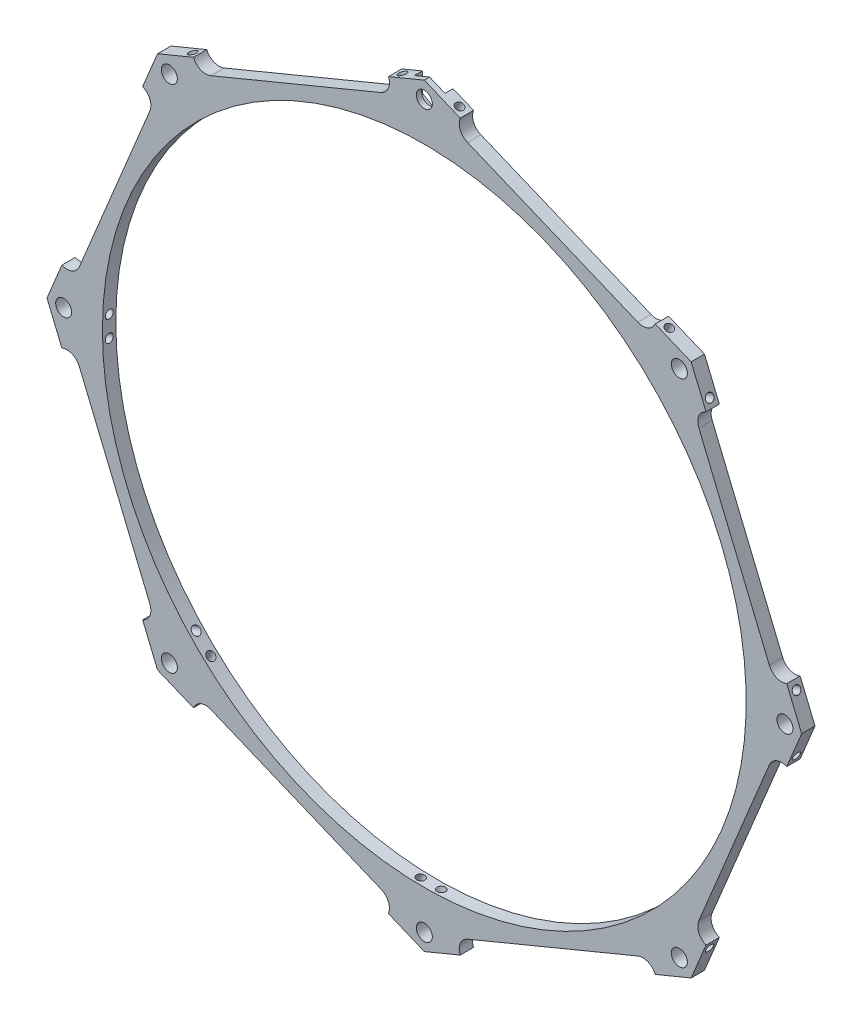
from build123d import *

# Parameters (mm, degrees)
BASE_CORNER_DEPTH               = 2.5
ROUNDING_I_R                    = 2.5
SENSOR_SCREW_D                  = 1.5
ROUNDING_I_OF_CORNER_MIRROR_R   = 2.5
SPACER_SCREW_D                  = 3
SPACER_ROTATION_COUNT           = 8
SKIZZE8_R                       = 1.5
SCHNITT_LINEAR_AUSTRAGEN2_DEPTH = 1.5


with BuildPart() as part:
    # Skizze1 → Base Corner (new body)
    with BuildSketch(Plane.XY):
        with BuildLine():
            Line((49.940187924, 49.940187924), (52.725141707, 43.216714729))
            Line((52.725141707, 43.216714729), (50.415442876, 42.260006148))
            Line((50.415442876, 42.260006148), (57.973440665, 24.013385381))
            Line((57.973440665, 24.013385381), (55.663741834, 23.0566768))
            ThreePointArc((55.663741834, 23.0566768), (50.096044141, 33.473106539), (42.603183566, 42.603183566))
            Line((42.603183566, 42.603183566), (49.940187924, 49.940187924))
        make_face()
    base_corner = extrude(amount=BASE_CORNER_DEPTH)

    # Rounding I
    rounding_i_edges = [part.edges().sort_by_distance(p)[0] for p in [
        (50.415442876, 42.260006148, 1.25),
    ]]
    fillet(rounding_i_edges, radius=ROUNDING_I_R - 0.0001)  # a hair under: the kernel refuses the full size

    # Sensor Screw (through all)
    with Locations(Plane(origin=(60.283139496, 24.970093962, 0), x_dir=(0, 0, -1), z_dir=(0.9238795325112876, 0.3826834323650878, 0))):
        with Locations((-1.25, 21.25)):
            sensor_screw = Hole(SENSOR_SCREW_D / 2)

    # Corner Mirror: Base Corner, Sensor Screw across plane
    add(base_corner.mirror(Plane(origin=(49.940187924, 49.940187924, 2.5), x_dir=(0, 0, 1), z_dir=(0.7071067811865429, -0.7071067811865522, 0))))
    add(sensor_screw.mirror(Plane(origin=(49.940187924, 49.940187924, 2.5), x_dir=(0, 0, 1), z_dir=(0.7071067811865429, -0.7071067811865522, 0))), mode=Mode.SUBTRACT)

    # Rounding I of Corner Mirror
    rounding_i_of_corner_mirror_edges = [part.edges().sort_by_distance(p)[0] for p in [
        (42.260006148, 50.415442876, 1.25),
    ]]
    fillet(rounding_i_of_corner_mirror_edges, radius=ROUNDING_I_OF_CORNER_MIRROR_R - 0.0001)  # a hair under: the kernel refuses the full size

    # Mirror 2: part across plane


with BuildPart() as part_1:
    add(part.part)
    add(part.part.mirror(Plane(origin=(24.013385381, 57.973440665, 2.5), x_dir=(0, 0, 1), z_dir=(-0.9238795325112815, 0.38268343236510255, 0))))

    # Mirror 3: part across plane


with BuildPart() as part_2:
    add(part_1.part)
    add(part_1.part.mirror(Plane(origin=(-24.013385381, 57.973440665, 2.5), x_dir=(0, 0, 1), z_dir=(0.9238795325112976, 0.38268343236506364, 0))))

    # Mirror 4: part across plane


with BuildPart() as part_3:
    add(part_2.part)
    add(part_2.part.mirror(Plane(origin=(-57.973440665, -24.013385381, 2.5), x_dir=(0, 0, 1), z_dir=(-0.3826834323650369, 0.9238795325113087, 0))))

    # Spacer Screw (through all)
    with Locations(Plane.XY.offset(2.5)):
        with Locations((47.72970773, 47.72970773)):
            spacer_screw = Hole(SPACER_SCREW_D / 2)

    # Spacer Rotation: Spacer Screw ×8 about axis
    spacer_rotation_axis = Axis((0, 0, 0), (0, 0, 1))
    for i in range(1, SPACER_ROTATION_COUNT):
        add(spacer_screw.rotate(spacer_rotation_axis, i * 360 / SPACER_ROTATION_COUNT), mode=Mode.SUBTRACT)

    # Skizze8 → Schnitt-Linear austragen2 (cut)
    # profile 1 of 7: a face of its own
    with BuildSketch(Plane(origin=(0, 0, 0), x_dir=(-1, 0, 0), z_dir=(0, 0, -1))):
        Polygon((-2.875, 69.159882024), (2.875, 69.159882024), (2.875, 65.840117976), (0, 64.180235952), (-2.875, 65.840117976), align=None)
        with Locations(Location((0, 67.5, 0), (0, 0, 180))):
            Circle(SKIZZE8_R, mode=Mode.SUBTRACT)
    # profile 2 of 7: a face of its own
    with BuildSketch(Plane(origin=(0, 0, 0), x_dir=(-1, 0, 0), z_dir=(0, 0, -1))):
        Polygon((-2.875, 69.435227077), (-1.187182104, 70.134344141), (0, 70.819764048), (-2.875, 70.819764048), align=None)
    # profile 3 of 7: a face of its own
    with BuildSketch(Plane(origin=(0, 0, 0), x_dir=(-1, 0, 0), z_dir=(0, 0, -1))):
        Polygon((0, 70.819764048), (1.187182104, 70.134344141), (2.875, 69.435227077), (2.875, 70.819764048), align=None)
    # profile 4 of 7: a face of its own
    with BuildSketch(Plane(origin=(0, 0, 0), x_dir=(-1, 0, 0), z_dir=(0, 0, -1))):
        Polygon((0, 70.626091069), (1.187182104, 70.134344141), (0, 70.819764048), (-1.187182104, 70.134344141), align=None)
    # profile 5 of 7: a face of its own
    with BuildSketch(Plane(origin=(0, 0, 0), x_dir=(-1, 0, 0), z_dir=(0, 0, -1))):
        Polygon((-2.875, 69.435227077), (-2.875, 69.159882024), (-1.187182104, 70.134344141), align=None)
    # profile 6 of 7: a face of its own
    with BuildSketch(Plane(origin=(0, 0, 0), x_dir=(-1, 0, 0), z_dir=(0, 0, -1))):
        Polygon((1.187182104, 70.134344141), (2.875, 69.159882024), (2.875, 69.435227077), align=None)
    # profile 7 of 7: a face of its own
    with BuildSketch(Plane(origin=(0, 0, 0), x_dir=(-1, 0, 0), z_dir=(0, 0, -1))):
        Polygon((-2.875, 69.159882024), (2.875, 69.159882024), (1.187182104, 70.134344141), (0, 70.626091069), (-1.187182104, 70.134344141), align=None)
    extrude(amount=-SCHNITT_LINEAR_AUSTRAGEN2_DEPTH, mode=Mode.SUBTRACT)


solid = part_3.part
